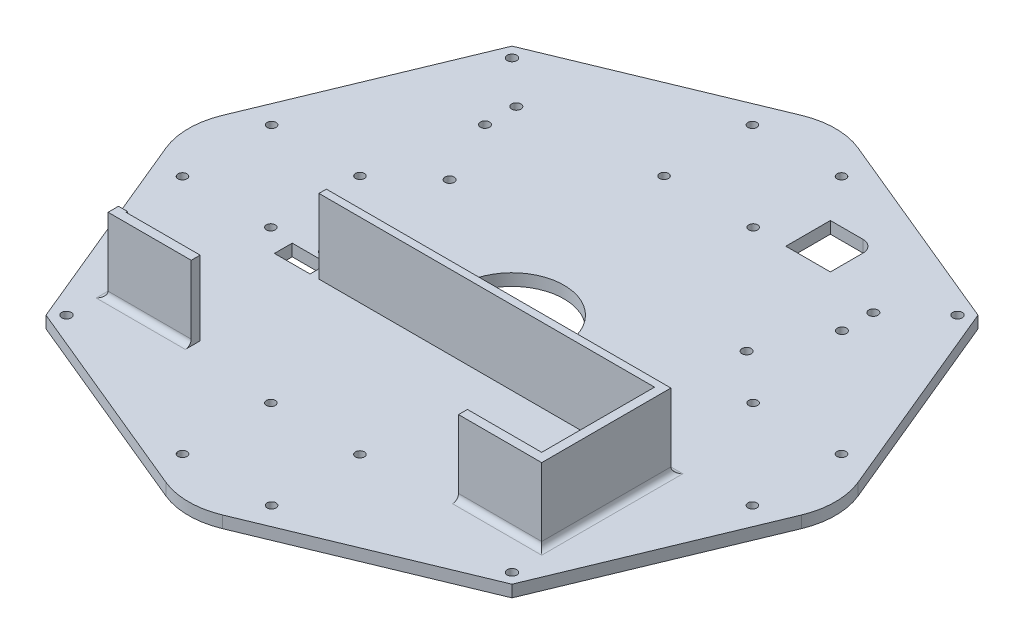
from build123d import *

# Parameters (mm, degrees)
BOSS_EXTRUDE2_DEPTH      = 4
CUT_EXTRUDE3_DEPTH       = 157.951186811
CUT_EXTRUDE3_DEPTH_BACK  = 157.951186811
SKETCH3_R                = 1.6
CUT_EXTRUDE6_DEPTH       = 157.951186811
CUT_EXTRUDE6_DEPTH_BACK  = 157.951186811
SKETCH6_R                = 17.5
SKETCH8_R                = 1.5
CUT_EXTRUDE7_DEPTH       = 4
CIRPATTERN1_COUNT        = 4
SKETCH10_R               = 1.55
CUT_EXTRUDE8_DEPTH       = 4
SKETCH11_W               = 146
SKETCH11_H               = 43.5
SKETCH11_W_2             = 140
SKETCH11_H_2             = 38
BOSS_EXTRUDE4_DEPTH      = 25
SKETCH12_W               = 90
SKETCH12_H               = 3
CUT_EXTRUDE9_DEPTH       = 25
FILLET1_R                = 2
SKETCH19_W               = 12
SKETCH19_H               = 6
CUT_EXTRUDE11_DEPTH      = 159.879435552
CUT_EXTRUDE12_DEPTH      = 159.879435552
CUT_EXTRUDE12_DEPTH_BACK = 159.879435552
SKETCH20_W               = 15
SKETCH20_H               = 15
FILLET2_R                = 25
FILLET3_R                = 4


with BuildPart() as part:
    # Sketch1 → Boss-Extrude2 (new body)
    with BuildSketch(Plane(origin=(0, 0, 0), x_dir=(1, 0, 0), z_dir=(0, 1, 0))):
        Polygon((0, -110.94520053), (78.450103635, -78.450103635), (110.94520053, 0), (78.450103635, 78.450103635), (0, 110.94520053), (-78.450103635, 78.450103635), (-110.94520053, 0), (-78.450103635, -78.450103635), align=None)
    extrude(amount=BOSS_EXTRUDE2_DEPTH)

    # Sketch3 → Cut-Extrude3 (cut, two sides: drawn at the far end of the back side and taken through both)
    with BuildSketch(Plane(origin=(0, 4, 0), x_dir=(1, 0, 0), z_dir=(0, 1, 0)).offset(-CUT_EXTRUDE3_DEPTH_BACK)):
        with Locations(Location((-75, -75, 0), (0, 0, 270))):
            Circle(SKETCH3_R)
        with Locations(Location((75, -75, 0), (0, 0, 270))):
            Circle(SKETCH3_R)
        with Locations(Location((75, 75, 0), (0, 0, 270))):
            Circle(SKETCH3_R)
        with Locations(Location((-75, 75, 0), (0, 0, 270))):
            Circle(SKETCH3_R)
    extrude(amount=CUT_EXTRUDE3_DEPTH + CUT_EXTRUDE3_DEPTH_BACK, mode=Mode.SUBTRACT)

    # Sketch6 → Cut-Extrude6 (cut, two sides: drawn at the far end of the back side and taken through both)
    with BuildSketch(Plane(origin=(0, 4, 0), x_dir=(1, 0, 0), z_dir=(0, 1, 0)).offset(-CUT_EXTRUDE6_DEPTH_BACK)):
        with Locations(Location((0, 0, 0), (0, 0, 270))):
            Circle(SKETCH6_R)
    extrude(amount=CUT_EXTRUDE6_DEPTH + CUT_EXTRUDE6_DEPTH_BACK, mode=Mode.SUBTRACT)

    # Sketch8 → Cut-Extrude7 (cut)
    with BuildSketch(Plane(origin=(0, 4, 0), x_dir=(1, 0, 0), z_dir=(0, 1, 0))):
        with Locations(Location((-15, -66.19520053, 0), (0, 0, 270))):
            Circle(SKETCH8_R)
        with Locations(Location((15, -66.19520053, 0), (0, 0, 270))):
            Circle(SKETCH8_R)
        with Locations(Location((-15, -95.94520053, 0), (0, 0, 270))):
            Circle(SKETCH8_R)
        with Locations(Location((15, -95.94520053, 0), (0, 0, 270))):
            Circle(SKETCH8_R)
    cut_extrude7 = extrude(amount=-CUT_EXTRUDE7_DEPTH, mode=Mode.SUBTRACT)

    # CirPattern1: Cut-Extrude7 ×4 about axis
    cirpattern1_axis = Axis((0, 0, 0), (0, 1, 0))
    for i in range(1, CIRPATTERN1_COUNT):
        add(cut_extrude7.rotate(cirpattern1_axis, i * 360 / CIRPATTERN1_COUNT), mode=Mode.SUBTRACT)

    # Sketch10 → Cut-Extrude8 (cut)
    with BuildSketch(Plane(origin=(0, 4, 0), x_dir=(1, 0, 0), z_dir=(0, 1, 0))):
        with Locations(Location((-50, 29, 0), (0, 0, 270))):
            Circle(SKETCH10_R)
        with Locations(Location((-50, -13, 0), (0, 0, 270))):
            Circle(SKETCH10_R)
        with Locations(Location((50, -13, 0), (0, 0, 270))):
            Circle(SKETCH10_R)
        with Locations(Location((50, 29, 0), (0, 0, 270))):
            Circle(SKETCH10_R)
        with Locations(Location((60.1, 51, 0), (0, 0, 270))):
            Circle(SKETCH10_R)
        with Locations(Location((-60.1, 61.564, 0), (0, 0, 270))):
            Circle(SKETCH10_R)
        with Locations(Location((60.1, 61.564, 0), (0, 0, 270))):
            Circle(SKETCH10_R)
        with Locations(Location((-60.1, 51, 0), (0, 0, 270))):
            Circle(SKETCH10_R)
    extrude(amount=-CUT_EXTRUDE8_DEPTH, mode=Mode.SUBTRACT)

    # Sketch11 → Boss-Extrude4 (add)
    with BuildSketch(Plane(origin=(0, 4, 0), x_dir=(1, 0, 0), z_dir=(0, 1, 0))):
        with Locations((0, -41.25)):
            Rectangle(SKETCH11_W, SKETCH11_H)
        with Locations((0, -41)):
            Rectangle(SKETCH11_W_2, SKETCH11_H_2, mode=Mode.SUBTRACT)
    extrude(amount=BOSS_EXTRUDE4_DEPTH)

    # Sketch12 → Cut-Extrude9 (cut)
    with BuildSketch(Plane(origin=(0, 29, 0), x_dir=(1, 0, 0), z_dir=(0, 1, 0))):
        Polygon((-73, -19.5), (-43, -19.5), (-43, -22), (-70, -22), (-70, -59.5), (-73, -59.5), align=None)
        with Locations((0, -61.5)):
            Rectangle(SKETCH12_W, SKETCH12_H)
    extrude(amount=-CUT_EXTRUDE9_DEPTH, mode=Mode.SUBTRACT)

    # Fillet1
    fillet1_edges = [part.edges().sort_by_distance(p)[0] for p in [
        (59, 4, 63),
        (-73, 4, 61.25),
        (73, 4, 41.25),
        (15, 4, 19.5),
        (-59, 4, 63),
    ]]
    fillet(fillet1_edges, radius=FILLET1_R - 0.0001)  # a hair under: the kernel refuses the full size

    # Sketch19 → Cut-Extrude11 (cut, through all)
    with BuildSketch(Plane(origin=(0, 4, 0), x_dir=(1, 0, 0), z_dir=(0, 1, 0))):
        with Locations((-52.000462783, -19)):
            Rectangle(SKETCH19_W, SKETCH19_H)
    extrude(amount=-CUT_EXTRUDE11_DEPTH, mode=Mode.SUBTRACT)

    # Sketch20 → Cut-Extrude12 (cut, two sides: drawn at the far end of the back side and taken through both)
    with BuildSketch(Plane(origin=(0, 4, 0), x_dir=(1, 0, 0), z_dir=(0, 1, 0)).offset(-CUT_EXTRUDE12_DEPTH_BACK)):
        with Locations((33.5, 73.69520053)):
            Rectangle(SKETCH20_W, SKETCH20_H)
    extrude(amount=CUT_EXTRUDE12_DEPTH + CUT_EXTRUDE12_DEPTH_BACK, mode=Mode.SUBTRACT)

    # Fillet2
    fillet2_edges = [part.edges().sort_by_distance(p)[0] for p in [
        (-110.94520053, 2, 0),
        (0, 2, -110.94520053),
        (110.94520053, 2, 0),
        (0, 2, 110.94520053),
    ]]
    fillet(fillet2_edges, radius=FILLET2_R)

    # Fillet3
    fillet3_edges = [part.edges().sort_by_distance(p)[0] for p in [
        (41, 2, -81.19520053),
    ]]
    fillet(fillet3_edges, radius=FILLET3_R)


solid = part.part
